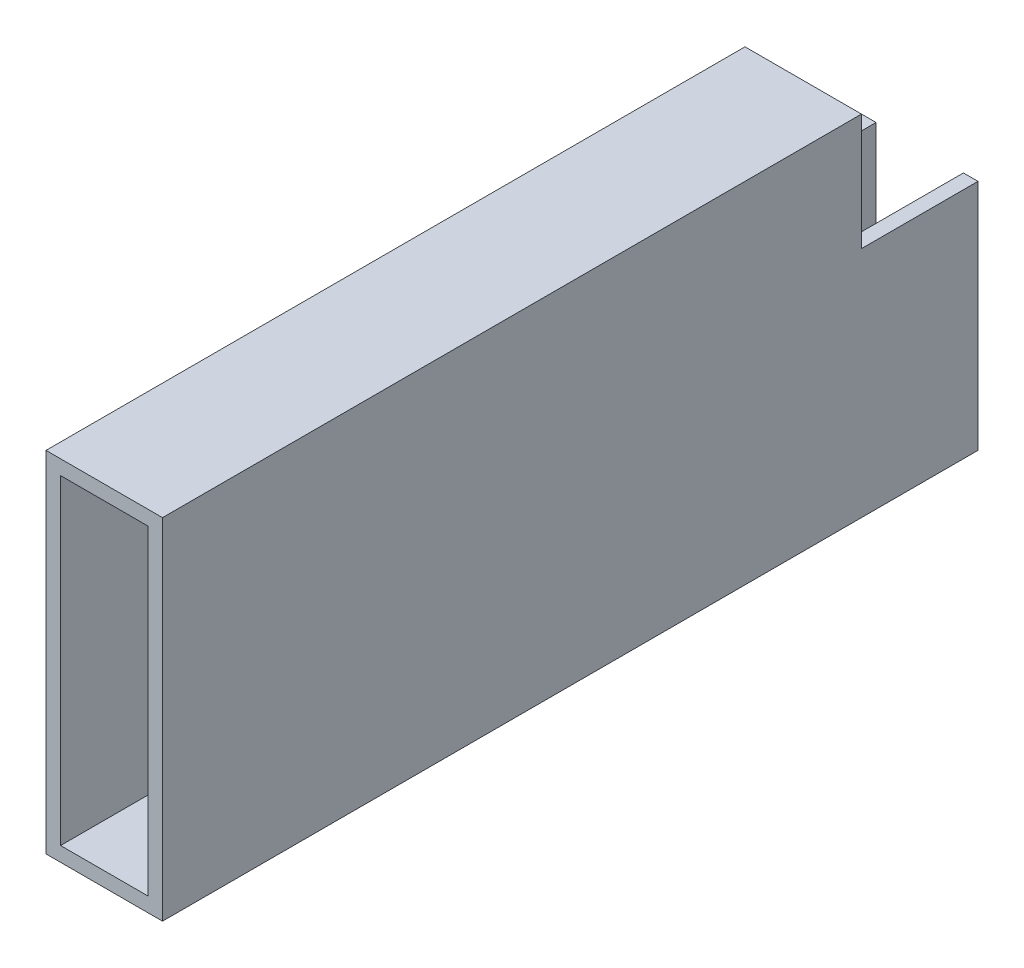
from build123d import *

# Parameters (mm, degrees)
SKETCH1_W           = 25.4
SKETCH1_H           = 76.2
BOSS_EXTRUDE1_DEPTH = 88.9
SHELL1_T            = -3.175
SKETCH2_W           = 25.4
SKETCH2_H           = 25.4
CUT_EXTRUDE1_DEPTH  = 100.9999


with BuildPart() as part:
    # Sketch1 → Boss-Extrude1 (new, symmetric)
    with BuildSketch(Plane.XY):
        Rectangle(SKETCH1_W, SKETCH1_H)
    extrude(amount=BOSS_EXTRUDE1_DEPTH, both=True)

    # Shell1
    shell1_openings = [part.faces().sort_by_distance(p)[0] for p in [
        (0, 0, -88.9),
        (0, 0, 88.9),
    ]]
    offset(amount=SHELL1_T, openings=shell1_openings, kind=Kind.INTERSECTION)

    # Sketch2 → Cut-Extrude1 (cut, through all)
    with BuildSketch(Plane.ZY.offset(12.7)):
        with Locations((-76.2, 25.4)):
            Rectangle(SKETCH2_W, SKETCH2_H)
    extrude(amount=-CUT_EXTRUDE1_DEPTH, mode=Mode.SUBTRACT)


solid = part.part
